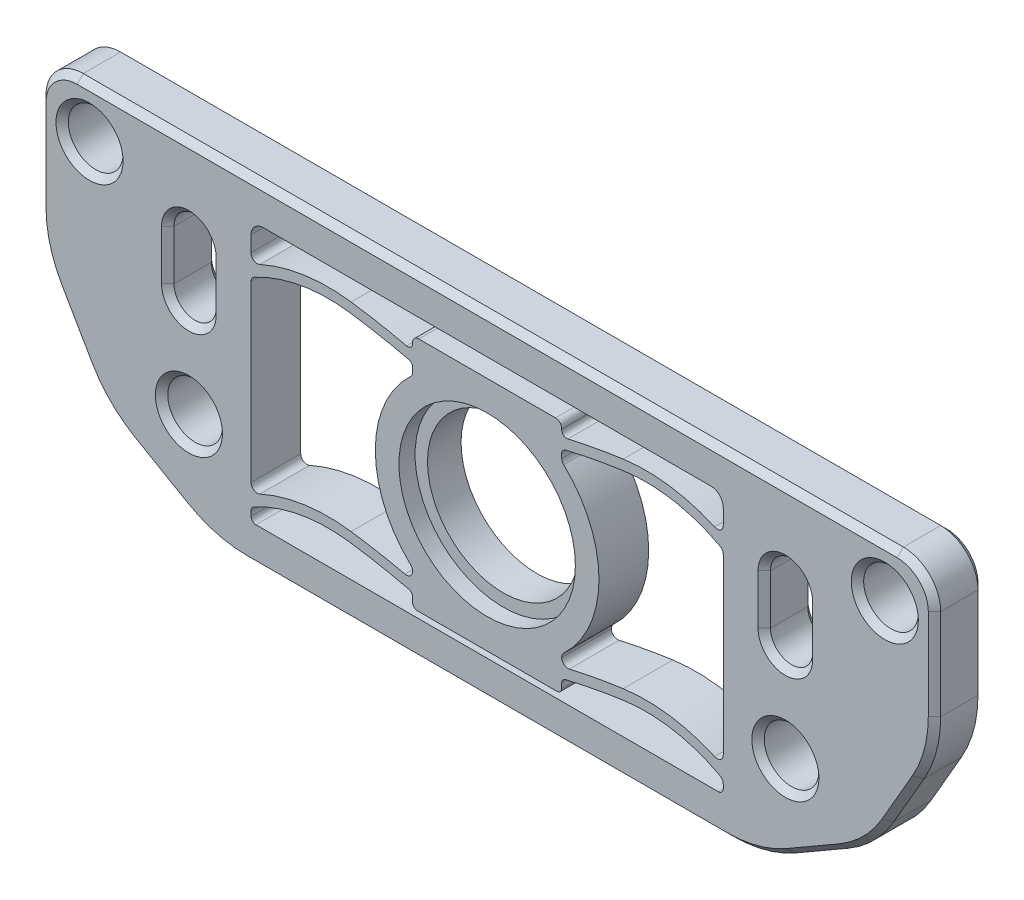
from build123d import *

# Parameters (mm, degrees)
SKETCH_2_R               = 7.1
SKETCH_2_R_2             = 6.1
EXTRUDE_1_DEPTH          = 2.7
SKETCH_2_3_R             = 9
SKETCH_2_3_R_2           = 7.1
EXTRUDE_2_DEPTH          = 4
EXTRUDE_3_DEPTH          = 4
SKETCH_4_W               = 44
SKETCH_4_H               = 27
SKETCH_4_W_2             = 38
SKETCH_4_H_2             = 21
EXTRUDE_4_DEPTH          = 4
EXTRUDE_1_2_DEPTH        = 4
DELETE_FACE_1_DEPTH      = 4
FILLET_4_R               = 0.5
FILLET_5_R               = 0.4
FILLET_6_R               = 1
SKETCH_8_R               = 2.2
EXTRUDE_7_DEPTH          = 4
CUT_EXTRUDE_1_DEPTH      = 39.832975817
CUT_EXTRUDE_1_DEPTH_BACK = 39.832975817
FILLET_7_R               = 10
FILLET_8_R               = 3
CHAMFER_1_SIZE           = 0.5


# Read off the part's stored shape, not the designer's step: 删除面1
with BuildPart() as part:
    # 草图2 → Extrude 1 (new body)
    with BuildSketch(Plane.XY):
        with Locations(Location((0, 0, 0), (0, 0, 180))):
            Circle(SKETCH_2_R)
        with Locations(Location((0, 0, 0), (0, 0, 180))):
            Circle(SKETCH_2_R_2, mode=Mode.SUBTRACT)
    extrude(amount=EXTRUDE_1_DEPTH)

    # 草图2<3> → 凸台-拉伸2 (add)
    with BuildSketch(Plane.XY):
        Circle(SKETCH_2_3_R)
        Circle(SKETCH_2_3_R_2, mode=Mode.SUBTRACT)
    extrude(amount=EXTRUDE_2_DEPTH)

    # 草图3 → 凸台-拉伸3 (add)
    with BuildSketch(Plane.XY):
        with BuildLine():
            Line((6, 6.708203932), (6, 9.5))
            Line((6, 9.5), (-6, 9.5))
            Line((-6, 9.5), (-6, 6.708203932))
            ThreePointArc((-6, 6.708203932), (0, 9), (6, 6.708203932))
        make_face()
        with BuildLine():
            Line((-6, -9.5), (6, -9.5))
            Line((6, -9.5), (6, -6.708203932))
            ThreePointArc((6, -6.708203932), (0, -9), (-6, -6.708203932))
            Line((-6, -6.708203932), (-6, -9.5))
        make_face()
    extrude(amount=EXTRUDE_3_DEPTH)



with BuildPart() as body_2:
    # 草图4 → 凸台-拉伸4 (new body)
    with BuildSketch(Plane.XY):
        with Locations((0, 0.5)):
            Rectangle(SKETCH_4_W, SKETCH_4_H)
        with Locations((0, 0.5)):
            Rectangle(SKETCH_4_W_2, SKETCH_4_H_2, mode=Mode.SUBTRACT)
    extrude(amount=EXTRUDE_4_DEPTH)


with BuildPart() as part_1:
    add(part.part)

    add(body_2.part)  # Extrude 1 2 merges body 2
    # 草图7 → Extrude 1 2 (add)
    with BuildSketch(Plane.XY):
        with BuildLine():
            ThreePointArc((19.19111663, -8.148610709), (15.188418529, -6.736776188), (10.944962783, -6.647601418))
            ThreePointArc((10.944962783, -6.647601418), (8.412688328, -7.06534444), (5.904962783, -7.611454086))
            Line((5.904962783, -7.611454086), (6.095037217, -8.388545914))
            ThreePointArc((6.095037217, -8.388545914), (8.562957594, -7.851104675), (11.055037217, -7.439992495))
            ThreePointArc((11.055037217, -7.439992495), (15.04515232, -7.523843398), (18.80888337, -8.851389291))
            Line((18.80888337, -8.851389291), (19.19111663, -8.148610709))
        make_face()
        with BuildLine():
            ThreePointArc((-18.80888337, -8.851389291), (-15.04515232, -7.523843398), (-11.055037217, -7.439992495))
            ThreePointArc((-11.055037217, -7.439992495), (-8.562957594, -7.851104675), (-6.095037217, -8.388545914))
            Line((-6.095037217, -8.388545914), (-5.904962783, -7.611454086))
            ThreePointArc((-5.904962783, -7.611454086), (-8.412688328, -7.06534444), (-10.944962783, -6.647601418))
            ThreePointArc((-10.944962783, -6.647601418), (-15.188418529, -6.736776188), (-19.19111663, -8.148610709))
            Line((-19.19111663, -8.148610709), (-18.80888337, -8.851389291))
        make_face()
        with BuildLine():
            ThreePointArc((-18.80888337, 7.148610709), (-15.04515232, 8.476156602), (-11.055037217, 8.560007505))
            ThreePointArc((-11.055037217, 8.560007505), (-8.562957594, 8.148895325), (-6.095037217, 7.611454086))
            Line((-6.095037217, 7.611454086), (-5.904962783, 8.388545914))
            ThreePointArc((-5.904962783, 8.388545914), (-8.412688328, 8.93465556), (-10.944962783, 9.352398582))
            ThreePointArc((-10.944962783, 9.352398582), (-15.188418529, 9.263223812), (-19.19111663, 7.851389291))
            Line((-19.19111663, 7.851389291), (-18.80888337, 7.148610709))
        make_face()
        with BuildLine():
            ThreePointArc((19.19111663, 7.851389291), (15.188418529, 9.263223812), (10.944962783, 9.352398582))
            ThreePointArc((10.944962783, 9.352398582), (8.412688328, 8.93465556), (5.904962783, 8.388545914))
            Line((5.904962783, 8.388545914), (6.095037217, 7.611454086))
            ThreePointArc((6.095037217, 7.611454086), (8.562957594, 8.148895325), (11.055037217, 8.560007505))
            ThreePointArc((11.055037217, 8.560007505), (15.04515232, 8.476156602), (18.80888337, 7.148610709))
            Line((18.80888337, 7.148610709), (19.19111663, 7.851389291))
        make_face()
    extrude(amount=EXTRUDE_1_2_DEPTH)

    # Delete Face 1 outline → Delete Face 1 (add)
    with BuildSketch(Plane.XY):
        with BuildLine():
            ThreePointArc((-19, 7.042506057), (-18.904671788, 7.095972847), (-18.80888337, 7.148610709))
            Line((-18.80888337, 7.148610709), (-19, 7.5))
            Line((-19, 7.5), (-19, 7.042506057))
        make_face()
        with BuildLine():
            Line((-6, 7.588108866), (-6, 8))
            Line((-6, 8), (-6.095037217, 7.611454086))
            ThreePointArc((-6.095037217, 7.611454086), (-6.047512851, 7.599804915), (-6, 7.588108866))
        make_face()
        with BuildLine():
            ThreePointArc((-19, -8.957493943), (-18.904671788, -8.904027153), (-18.80888337, -8.851389291))
            Line((-18.80888337, -8.851389291), (-19, -8.5))
            Line((-19, -8.5), (-19, -8.957493943))
        make_face()
        with BuildLine():
            Line((-6, -8.411891134), (-6, -8))
            Line((-6, -8), (-6.095037217, -8.388545914))
            ThreePointArc((-6.095037217, -8.388545914), (-6.047512851, -8.400195085), (-6, -8.411891134))
        make_face()
        with BuildLine():
            Line((6.095037217, 7.611454086), (6, 8))
            Line((6, 8), (6, 7.588108866))
            ThreePointArc((6, 7.588108866), (6.047512851, 7.599804915), (6.095037217, 7.611454086))
        make_face()
        with BuildLine():
            Line((19, 7.5), (18.80888337, 7.148610709))
            ThreePointArc((18.80888337, 7.148610709), (18.904671788, 7.095972847), (19, 7.042506057))
            Line((19, 7.042506057), (19, 7.5))
        make_face()
        with BuildLine():
            Line((6.095037217, -8.388545914), (6, -8))
            Line((6, -8), (6, -8.411891134))
            ThreePointArc((6, -8.411891134), (6.047512851, -8.400195085), (6.095037217, -8.388545914))
        make_face()
        with BuildLine():
            Line((19, -8.5), (18.80888337, -8.851389291))
            ThreePointArc((18.80888337, -8.851389291), (18.904671788, -8.904027153), (19, -8.957493943))
            Line((19, -8.957493943), (19, -8.5))
        make_face()
    extrude(amount=DELETE_FACE_1_DEPTH)

    # 圆角4
    fillet_4_edges = [part_1.edges().sort_by_distance(p)[0] for p in [
        (19, -8.046657496, 2),
        (6, -7.588305973, 2),
        (-19, -8.046657496, 2),
        (-6, -7.588305973, 2),
        (-6, 9.5, 2),
        (6, 9.5, 2),
        (6, 6.708203932, 2),
        (19, -8.957493943, 2),
        (-6, 6.708203932, 2),
        (-19, -8.957493943, 2),
        (-19, 7.042506057, 2),
        (19, 7.042506057, 2),
        (6, -6.708203932, 2),
        (-6, -6.708203932, 2),
        (-19, 7.953342504, 2),
        (19, 7.953342504, 2),
    ]]
    fillet(fillet_4_edges, radius=FILLET_4_R)

    # 圆角5
    fillet_5_edges = [part_1.edges().sort_by_distance(p)[0] for p in [
        (6, -8.411891134, 2),
        (-6, -8.411891134, 2),
        (-6, 7.588108866, 2),
        (6, 7.588108866, 2),
        (-6, -9.5, 2),
        (6, -9.5, 2),
        (-6, 8.411694027, 2),
        (-19, -10, 2),
        (19, -10, 2),
        (6, 8.411694027, 2),
    ]]
    fillet(fillet_5_edges, radius=FILLET_5_R)

    # 圆角6
    fillet_6_edges = [part_1.edges().sort_by_distance(p)[0] for p in [
        (19, 11, 2),
        (-19, 11, 2),
    ]]
    fillet(fillet_6_edges, radius=FILLET_6_R)

    # 草图8 → 凸台-拉伸7 (add)
    # profile 1 of 2: a face of its own
    with BuildSketch(Plane.XY):
        Polygon((-30.875644347, -7.875644347), (-22, -13), (-22, 14), (-36, 14), (-36, 1), align=None)
        with BuildLine():
            ThreePointArc((-22.3, 3), (-24, 1.3), (-25.7, 3))
            Line((-25.7, 3), (-25.7, 7))
            ThreePointArc((-25.7, 7), (-24, 8.7), (-22.3, 7))
            Line((-22.3, 7), (-22.3, 3))
        make_face(mode=Mode.SUBTRACT)
        with Locations((-32, 10)):
            Circle(SKETCH_8_R, mode=Mode.SUBTRACT)
    # profile 2 of 2: a face of its own
    with BuildSketch(Plane.XY):
        Polygon((22, -13), (30.875644347, -7.875644347), (36, 1), (36, 14), (22, 14), align=None)
        with BuildLine():
            Line((25.7, 7), (25.7, 3))
            ThreePointArc((25.7, 3), (24, 1.3), (22.3, 3))
            Line((22.3, 3), (22.3, 7))
            ThreePointArc((22.3, 7), (24, 8.7), (25.7, 7))
        make_face(mode=Mode.SUBTRACT)
        with Locations((32, 10)):
            Circle(SKETCH_8_R, mode=Mode.SUBTRACT)
    extrude(amount=EXTRUDE_7_DEPTH)

    # 草图8<3> → 切除-拉伸1 (cut, two sides: drawn at the far end of the back side and taken through both)
    with BuildSketch(Plane.XY.offset(-CUT_EXTRUDE_1_DEPTH_BACK)):
        with BuildLine():
            ThreePointArc((-22, -4.083484861), (-26.2, -5), (-22, -5.916515139))
            Line((-22, -5.916515139), (-22, -4.083484861))
        make_face()
        with BuildLine():
            Line((-22, -4.083484861), (-22, -5.916515139))
            ThreePointArc((-22, -5.916515139), (-21.850581474, -5.469041576), (-21.8, -5))
            ThreePointArc((-21.8, -5), (-21.850581474, -4.530958424), (-22, -4.083484861))
        make_face()
        with BuildLine():
            ThreePointArc((22, -4.083484861), (21.8, -5), (22, -5.916515139))
            Line((22, -5.916515139), (22, -4.083484861))
        make_face()
        with BuildLine():
            Line((22, -4.083484861), (22, -5.916515139))
            ThreePointArc((22, -5.916515139), (24.469041576, -7.149418526), (26.2, -5))
            ThreePointArc((26.2, -5), (24.469041576, -2.850581474), (22, -4.083484861))
        make_face()
    extrude(amount=CUT_EXTRUDE_1_DEPTH + CUT_EXTRUDE_1_DEPTH_BACK, mode=Mode.SUBTRACT)

    # 圆角7
    fillet_7_edges = [part_1.edges().sort_by_distance(p)[0] for p in [
        (-30.875644347, -7.875644347, 2),
        (-36, 1, 2),
        (30.875644347, -7.875644347, 2),
        (36, 1, 2),
        (22, -13, 2),
        (-22, -13, 2),
    ]]
    fillet(fillet_7_edges, radius=FILLET_7_R)

    # 圆角8
    fillet_8_edges = [part_1.edges().sort_by_distance(p)[0] for p in [
        (-36, 14, 2),
        (36, 14, 2),
    ]]
    fillet(fillet_8_edges, radius=FILLET_8_R)

    # 倒角1
    chamfer_1_edges = [part_1.edges().sort_by_distance(p)[0] for p in [
        (-24, 8.7, 4),
        (-22.3, 5, 4),
        (-24, 1.3, 4),
        (-34.2, 10, 4),
        (-25.7, 5, 0),
        (-34.2, 10, 0),
        (-24, 8.7, 0),
        (-24, 1.3, 0),
        (-22.3, 5, 0),
        (-25.7, 5, 4),
        (22.3, 5, 0),
        (24, 8.7, 0),
        (25.7, 5, 4),
        (24, 1.3, 0),
        (29.8, 10, 0),
        (25.7, 5, 0),
        (29.8, 10, 4),
        (24, 1.3, 4),
        (22.3, 5, 4),
        (24, 8.7, 4),
        (-26, -4.083484861, 0),
        (-26, -4.083484861, 4),
        (26, -5.916515139, 4),
        (26, -5.916515139, 0),
        (36, 7.339745962, 4),
        (36, 7.339745962, 0),
        (33.437822174, -3.437822174, 0),
        (26.437822174, -10.437822174, 0),
        (0, -13, 0),
        (-26.437822174, -10.437822174, 0),
        (-33.437822174, -3.437822174, 0),
        (-36, 7.339745962, 0),
        (-21.908698527, -12.659258263, 0),
        (-30.626204083, -7.626204083, 0),
        (-35.659258263, 1.091301473, 0),
        (21.908698527, -12.659258263, 0),
        (30.626204083, -7.626204083, 0),
        (35.659258263, 1.091301473, 0),
        (33.437822174, -3.437822174, 4),
        (0, -13, 4),
        (26.437822174, -10.437822174, 4),
        (-36, 7.339745962, 4),
        (-33.437822174, -3.437822174, 4),
        (-26.437822174, -10.437822174, 4),
        (-21.908698527, -12.659258263, 4),
        (-30.626204083, -7.626204083, 4),
        (-35.659258263, 1.091301473, 4),
        (21.908698527, -12.659258263, 4),
        (30.626204083, -7.626204083, 4),
        (35.659258263, 1.091301473, 4),
        (0, 14, 0),
        (35.121320344, 13.121320344, 0),
        (-35.121320344, 13.121320344, 0),
        (0, 14, 4),
        (35.121320344, 13.121320344, 4),
        (-35.121320344, 13.121320344, 4),
    ]]
    chamfer(chamfer_1_edges, length=CHAMFER_1_SIZE)


solid = part_1.part
